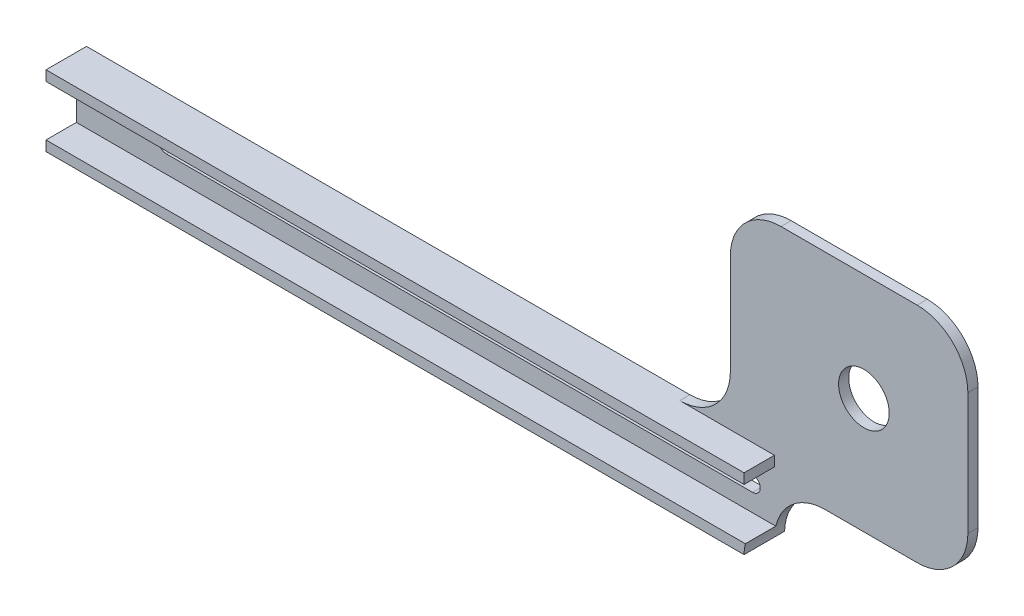
from build123d import *

# Parameters (mm, degrees)
BOSS_EXTRUDE1_DEPTH = 2.54
SKETCH2_R           = 6.35
CUT_EXTRUDE1_DEPTH  = 2.54
SKETCH3_W           = 175.067056309
SKETCH3_H           = 2.54
BOSS_EXTRUDE2_DEPTH = 7.62
SKETCH4_W           = 175.067056309
SKETCH4_H           = 29.21
SKETCH4_W_2         = 164.016975536
SKETCH4_H_2         = 66.475239383
SKETCH4_W_3         = 84.822418372
SKETCH4_H_3         = 89.286756182
CUT_EXTRUDE2_DEPTH  = 2.54
FILLET1_R           = 12.7


with BuildPart() as part:
    # Sketch1 → Boss-Extrude1 (new body)
    with BuildSketch(Plane.XY.offset(-12.457776114)):
        Polygon((-175.067056309, 77.80274772), (129.732943691, 77.80274772), (129.732943691, 21.857628122), (0, 21.857628122), (0, -19.695936064), (-175.067056309, -19.695936064), align=None)
        with BuildLine():
            Line((-152.479240823, 20.309063936), (-5.464407031, 20.309063936))
            ThreePointArc((-5.464407031, 20.309063936), (-3.559407031, 18.404063936), (-5.464407031, 16.499063936))
            Line((-5.464407031, 16.499063936), (-152.479240823, 16.499063936))
            ThreePointArc((-152.479240823, 16.499063936), (-154.384240823, 18.404063936), (-152.479240823, 20.309063936))
        make_face(mode=Mode.SUBTRACT)
    extrude(amount=-BOSS_EXTRUDE1_DEPTH)

    # Sketch2 → Cut-Extrude1 (cut)
    with BuildSketch(Plane.XY.offset(-12.457776114)):
        with Locations((22.439796045, 50.825535486)):
            Circle(SKETCH2_R)
    extrude(amount=-CUT_EXTRUDE1_DEPTH, mode=Mode.SUBTRACT)

    # Sketch3 → Boss-Extrude2 (add)
    with BuildSketch(Plane.XY.offset(-12.457776114)):
        with Locations((-87.533528155, 26.024063936)):
            Rectangle(SKETCH3_W, SKETCH3_H)
        with Locations((-87.533528155, 10.784063936)):
            Rectangle(SKETCH3_W, SKETCH3_H)
    extrude(amount=BOSS_EXTRUDE2_DEPTH)

    # Sketch4 → Cut-Extrude2 (cut)
    with BuildSketch(Plane.XY.offset(-12.457776114)):
        with Locations((-87.533528155, -5.090936064)):
            Rectangle(SKETCH4_W, SKETCH4_H)
        with Locations((-93.058568541, 60.531683628)):
            Rectangle(SKETCH4_W_2, SKETCH4_H_2)
        with Locations((90.924098408, 47.502895008)):
            Rectangle(SKETCH4_W_3, SKETCH4_H_3)
    extrude(amount=-CUT_EXTRUDE2_DEPTH, mode=Mode.SUBTRACT)

    # Fillet1
    # the kernel refuses this fillet: 12.7 mm, written as the material it adds along each edge
    with BuildSketch(Plane(origin=(-11.050080773, 27.294063936, -12.457776114), x_dir=(0, 1, 0), z_dir=(0, 0, -1))) as fillet1_piece_1:
        with BuildLine():
            CenterArc((FILLET1_R, -FILLET1_R), FILLET1_R, 90, 90)
            Line((0, -FILLET1_R), (0, 0))
            Line((0, 0), (FILLET1_R, 0))
        make_face()
    extrude(amount=2.54)
    with BuildSketch(Plane(origin=(0, 21.857628122, 19.279716847), x_dir=(0, -1, 0), z_dir=(0, 0, -1))) as fillet1_piece_2_section:
        with BuildLine():
            CenterArc((12.7, -12.694997184), FILLET1_R, 91.608263763, 88.391736237)
            Line((0, -12.694997184), (0, 0))
            Line((0, 0), (12.343564187, 0))
        make_face()
    fillet1_piece_2 = extrude(amount=34.277492961, mode=Mode.PRIVATE)
    fillet1_piece_2 = split(fillet1_piece_2, bisect_by=Plane(origin=(0, 12.054063936, 19.279716847), z_dir=(0, -1, 0)), keep=Keep.TOP, mode=Mode.PRIVATE)
    fillet1_piece_2 = split(fillet1_piece_2, bisect_by=Plane(origin=(0, 21.857628122, -4.837776114), z_dir=(0, 0, -1)), keep=Keep.TOP, mode=Mode.PRIVATE)
    add(fillet1_piece_2)
    with BuildSketch(Plane(origin=(0, 21.857628122, -12.457776114), x_dir=(0, -1, 0), z_dir=(0, 0, -1))) as fillet1_piece_3:
        with BuildLine():
            CenterArc((12.7, -12.694997184), FILLET1_R, 91.608263763, 88.391736237)
            Line((0, -12.694997184), (0, 0))
            Line((0, 0), (12.343564187, 0))
        make_face()
    extrude(amount=2.54)
    # the kernel refuses this fillet: 12.7 mm, written as the material it takes off along each edge
    with BuildSketch(Plane(origin=(48.512889222, 21.857628122, -46.747776114), x_dir=(-1, 0, 0), z_dir=(0, 0, 1)), Plane(origin=(48.512889222, 77.80274772, 19.292223886), x_dir=(-1, 0, 0), z_dir=(0, 0, -1)), Plane(origin=(-11.050080773, 77.80274772, -46.747776114), x_dir=(1, 0, 0), z_dir=(0, 0, 1))) as fillet1_2_piece_1:
        with BuildLine():
            CenterArc((FILLET1_R, -FILLET1_R), FILLET1_R, 90, 90)
            Line((0, -FILLET1_R), (0, 0))
            Line((0, 0), (FILLET1_R, 0))
        make_face()
    extrude(amount=66.04, mode=Mode.SUBTRACT)


solid = part.part
